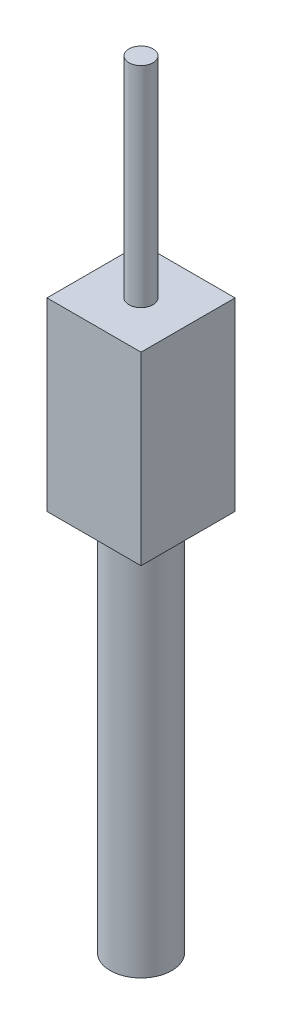
from build123d import *

# Parameters (mm, degrees)
SKETCH1_R           = 5
BOSS_EXTRUDE1_DEPTH = 62
SKETCH3_W           = 15.25
SKETCH3_H           = 15.25
BOSS_EXTRUDE2_DEPTH = 30
SKETCH4_R           = 1.95
BOSS_EXTRUDE3_DEPTH = 34
SKETCH5_R           = 3
CUT_EXTRUDE1_DEPTH  = 10


with BuildPart() as part:
    # Sketch1 → Boss-Extrude1 (new body)
    with BuildSketch(Plane(origin=(0, 0, 0), x_dir=(1, 0, 0), z_dir=(0, 1, 0))):
        Circle(SKETCH1_R)
    extrude(amount=BOSS_EXTRUDE1_DEPTH)

    # Sketch3 → Boss-Extrude2 (add)
    with BuildSketch(Plane(origin=(0, 62, 0), x_dir=(1, 0, 0), z_dir=(0, 1, 0))):
        Rectangle(SKETCH3_W, SKETCH3_H)
    extrude(amount=BOSS_EXTRUDE2_DEPTH)

    # Sketch4 → Boss-Extrude3 (add)
    with BuildSketch(Plane(origin=(0, 92, 0), x_dir=(1, 0, 0), z_dir=(0, 1, 0))):
        Circle(SKETCH4_R)
    extrude(amount=BOSS_EXTRUDE3_DEPTH)

    # Sketch5 → Cut-Extrude1 (cut)
    with BuildSketch(Plane.XZ):
        Circle(SKETCH5_R)
    extrude(amount=-CUT_EXTRUDE1_DEPTH, mode=Mode.SUBTRACT)


solid = part.part
